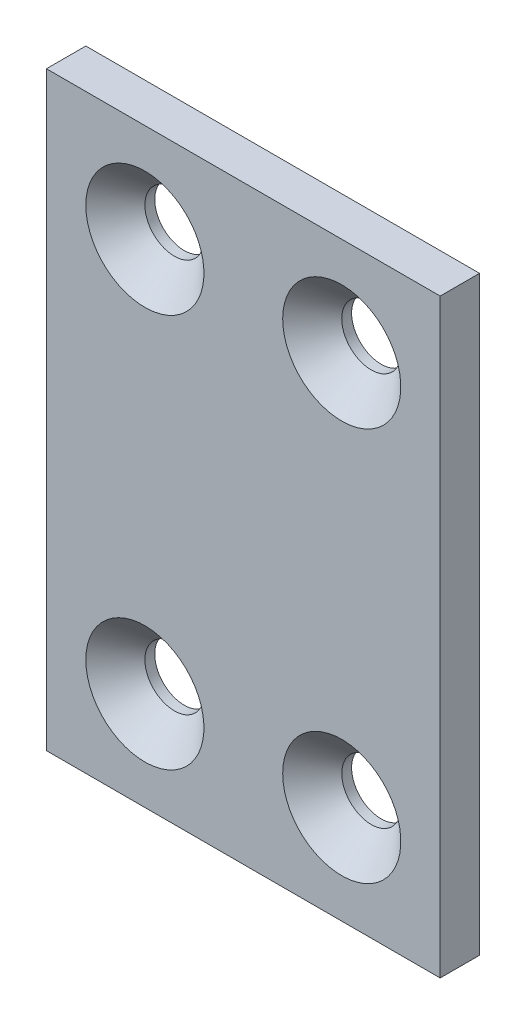
from build123d import *

# Parameters (mm, degrees)
SKETCH1_W           = 40
SKETCH1_H           = 60
BOSS_EXTRUDE1_DEPTH = 2
SKETCH2_R           = 3
CUT_EXTRUDE1_DEPTH  = 37.276714294
CHAMFER1_SIZE       = 3


with BuildPart() as part:
    # Sketch1 → Boss-Extrude1 (new, symmetric)
    with BuildSketch(Plane.XY):
        Rectangle(SKETCH1_W, SKETCH1_H)
    extrude(amount=BOSS_EXTRUDE1_DEPTH, both=True)

    # Sketch2 → Cut-Extrude1 (cut, through all)
    with BuildSketch(Plane.XY.offset(2)):
        with Locations((-10, 20)):
            Circle(SKETCH2_R)
        with Locations((10, 20)):
            Circle(SKETCH2_R)
        with Locations((-10, -20)):
            Circle(SKETCH2_R)
        with Locations((10, -20)):
            Circle(SKETCH2_R)
    extrude(amount=-CUT_EXTRUDE1_DEPTH, mode=Mode.SUBTRACT)

    # Chamfer1
    chamfer1_edges = [part.edges().sort_by_distance(p)[0] for p in [
        (7, -20, 2),
        (-13, -20, 2),
        (7, 20, 2),
        (-13, 20, 2),
    ]]
    chamfer(chamfer1_edges, length=CHAMFER1_SIZE)


solid = part.part
